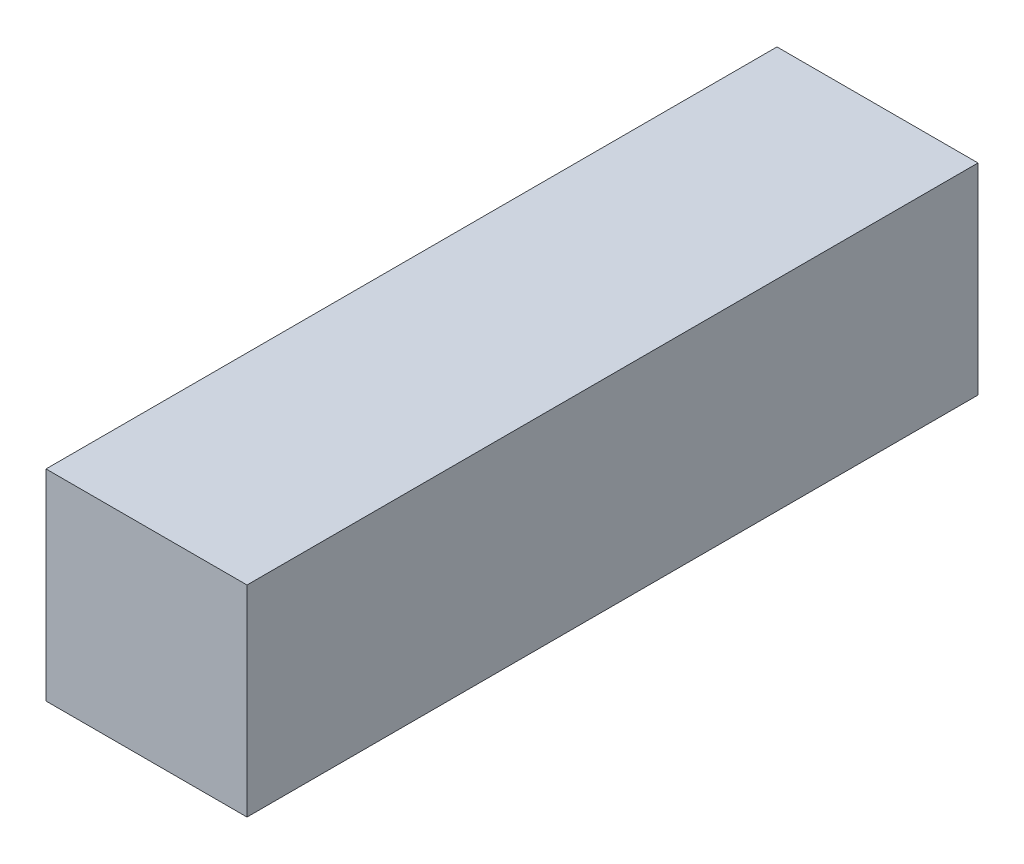
from build123d import *

# Parameters (mm, degrees)
SKETCH1_W           = 27.5
SKETCH1_H           = 27.5
BOSS_EXTRUDE1_DEPTH = 100


with BuildPart() as part:
    # Sketch1 → Boss-Extrude1 (new body)
    with BuildSketch(Plane(origin=(0, 0, 0), x_dir=(0, 1, 0), z_dir=(0, 0, 1))):
        Rectangle(SKETCH1_W, SKETCH1_H)
    extrude(amount=BOSS_EXTRUDE1_DEPTH)


solid = part.part
